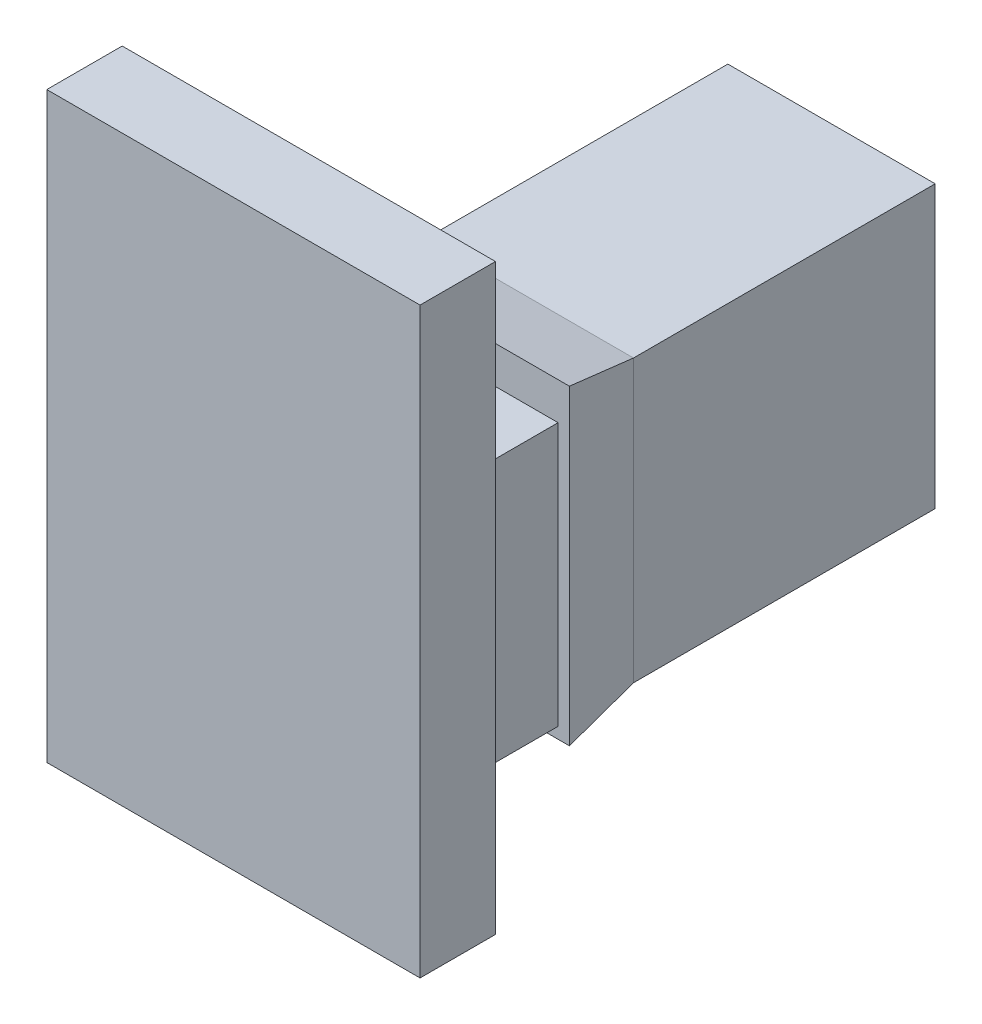
from build123d import *

# Parameters (mm, degrees)
EXTRUDE_1_DEPTH      = 0.2
EXTRUDE_1_DEPTH_BACK = 1.7
SKETCH_2_W           = 2.749
SKETCH_2_H           = 3.486646178
SKETCH_3_W           = 4.948986656
SKETCH_3_H           = 7.726872963
EXTRUDE_2_DEPTH      = 1
SKETCH_8_W           = 2.749
SKETCH_8_H           = 3.729608675
EXTRUDE_3_DEPTH      = 4
SKETCH_9_W           = 2.220876602
SKETCH_9_H           = 2.202369297
CUT_EXTRUDE_1_DEPTH  = 3.5


with BuildPart() as part:
    # 草图2 → 凸台-拉伸1 (new, two sides: drawn at the far end of the back side and taken through both)
    with BuildSketch(Plane.XY.offset(-EXTRUDE_1_DEPTH_BACK)):
        with Locations((-2.824500159, -34.686907223)):
            Rectangle(SKETCH_2_W, SKETCH_2_H)
    extrude(amount=EXTRUDE_1_DEPTH + EXTRUDE_1_DEPTH_BACK)

    # 草图3 → 凸台-拉伸2 (add)
    with BuildSketch(Plane.XY.offset(0.2)):
        with Locations((-2.854795759, -33.471663218)):
            Rectangle(SKETCH_3_W, SKETCH_3_H)
    extrude(amount=EXTRUDE_2_DEPTH)

    # 放样1: read off the stored shape, not the designer's step
    # 放样1: loft between two sections, ruled curve by curve
    loft_1_from = [
        Edge.make_line((-1.450000159, -32.700621637, -2.7), (-1.450000159, -36.430230312, -2.7)),
        Edge.make_line((-1.450000159, -36.430230312, -2.7), (-4.199000159, -36.430230312, -2.7)),
        Edge.make_line((-4.199000159, -36.430230312, -2.7), (-4.199000159, -32.700621637, -2.7)),
        Edge.make_line((-4.199000159, -32.700621637, -2.7), (-1.450000159, -32.700621637, -2.7)),
    ]
    loft_1_to = [
        Edge.make_line((-1.300000159, -32.449611662, -1.7), (-1.300000159, -36.579532352, -1.7)),
        Edge.make_line((-1.300000159, -36.579532352, -1.7), (-4.299000159, -36.579532352, -1.7)),
        Edge.make_line((-4.299000159, -36.579532352, -1.7), (-4.299000159, -32.449611662, -1.7)),
        Edge.make_line((-4.299000159, -32.449611662, -1.7), (-1.300000159, -32.449611662, -1.7)),
    ]
    loft_1 = Solid(Shell([*[Face.make_surface_from_curves(loft_1_from[k], loft_1_to[k]) for k in range(4)], Face(Wire(loft_1_from)), Face(Wire(loft_1_to))]))
    add(loft_1)

    # 草图8 → 凸台-拉伸3 (add)
    with BuildSketch(Plane(origin=(0, 0, -2.7), x_dir=(-1, 0, 0), z_dir=(0, 0, -1))):
        with Locations((2.824500159, -34.565425975)):
            Rectangle(SKETCH_8_W, SKETCH_8_H)
    extrude(amount=EXTRUDE_3_DEPTH)

    # 草图9 → 切除-拉伸1 (cut)
    with BuildSketch(Plane(origin=(0, 0, -6.7), x_dir=(-1, 0, 0), z_dir=(0, 0, -1))):
        with Locations((2.92610545, -34.854711182)):
            Rectangle(SKETCH_9_W, SKETCH_9_H)
    extrude(amount=-CUT_EXTRUDE_1_DEPTH, mode=Mode.SUBTRACT)


solid = part.part
